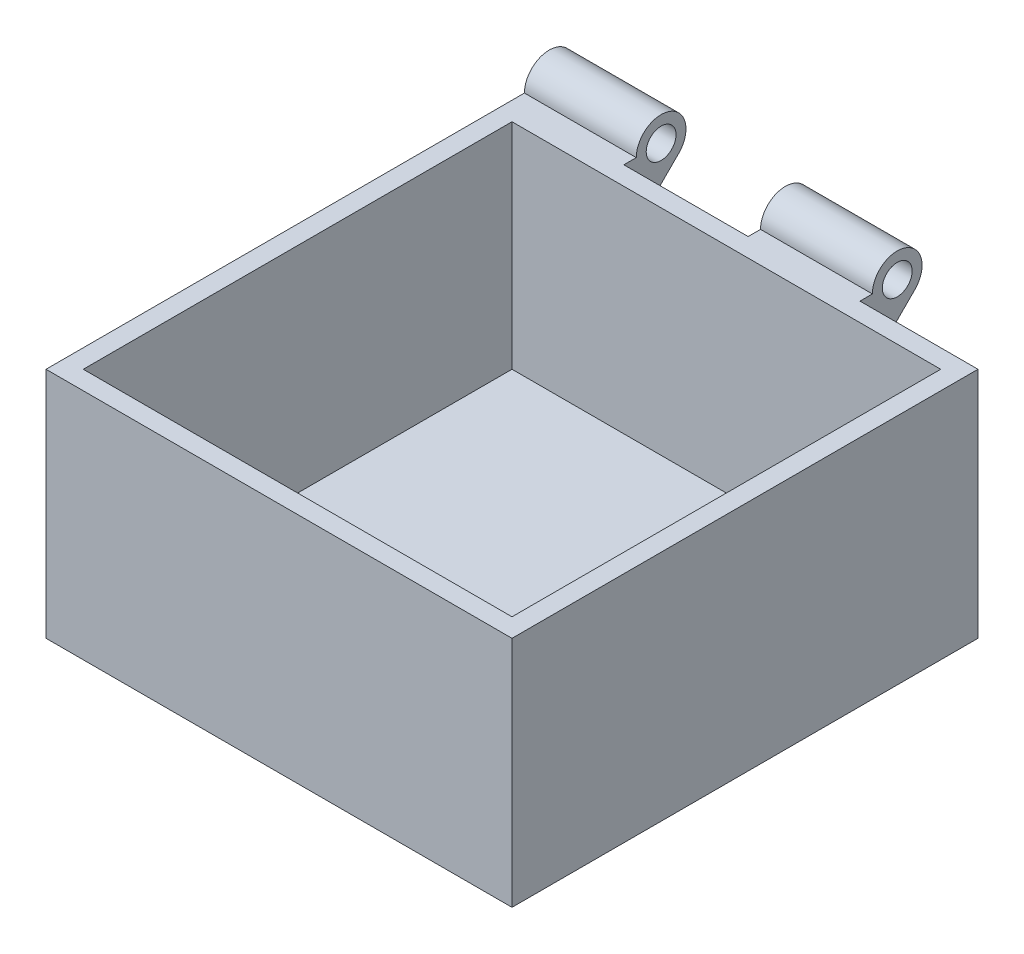
from build123d import *

# Parameters (mm, degrees)
SKETCH1_W           = 95.25
SKETCH1_H           = 95.25
BOSS_EXTRUDE1_DEPTH = 47.625
SHELL1_T            = -3.81
SKETCH2_R           = 3.048
BOSS_EXTRUDE2_DEPTH = 22.86
BOSS_EXTRUDE3_START = -46.99
SKETCH5_R           = 3.048
BOSS_EXTRUDE3_DEPTH = 22.86


with BuildPart() as part:
    # Sketch1 → Boss-Extrude1 (new body)
    with BuildSketch(Plane(origin=(0, 0, 0), x_dir=(1, 0, 0), z_dir=(0, 1, 0))):
        Rectangle(SKETCH1_W, SKETCH1_H)
    extrude(amount=BOSS_EXTRUDE1_DEPTH)

    # Shell1
    shell1_openings = [part.faces().sort_by_distance(p)[0] for p in [
        (0, 47.625, 0),
    ]]
    offset(amount=SHELL1_T, openings=shell1_openings, kind=Kind.INTERSECTION)

    # Sketch2 → Boss-Extrude2 (add)
    with BuildSketch(Plane.ZY.offset(47.625)):
        with BuildLine():
            ThreePointArc((-50.165, 47.625), (-57.189031836, 52.318308025), (-58.837102448, 44.032897552))
            Line((-58.837102448, 44.032897552), (-47.625, 32.820795103))
            Line((-47.625, 32.820795103), (-47.625, 47.625))
            Line((-47.625, 47.625), (-50.165, 47.625))
        make_face()
        with Locations((-55.245, 47.625)):
            Circle(SKETCH2_R, mode=Mode.SUBTRACT)
    extrude(amount=-BOSS_EXTRUDE2_DEPTH)

    # Sketch5 → Boss-Extrude3 (add)
    with BuildSketch(Plane(origin=(47.625, 0, 0), x_dir=(0, 0, -1), z_dir=(1, 0, 0)).offset(BOSS_EXTRUDE3_START)):
        with BuildLine():
            Line((50.165, 47.625), (47.625, 47.625))
            Line((47.625, 47.625), (47.625, 32.820795103))
            Line((47.625, 32.820795103), (58.837102448, 44.032897552))
            ThreePointArc((58.837102448, 44.032897552), (57.189031836, 52.318308025), (50.165, 47.625))
        make_face()
        with Locations((55.245, 47.625)):
            Circle(SKETCH5_R, mode=Mode.SUBTRACT)
    extrude(amount=BOSS_EXTRUDE3_DEPTH)


solid = part.part
